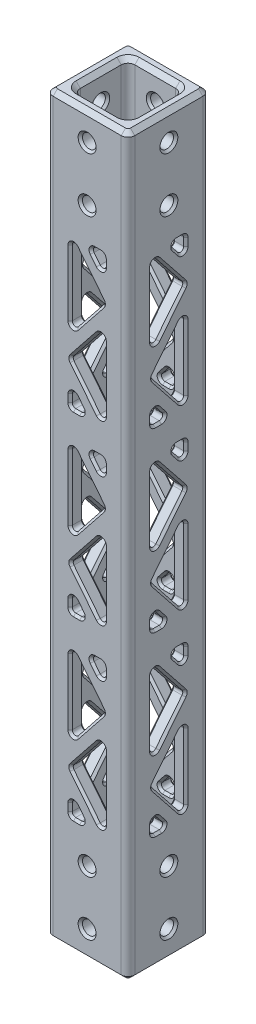
from build123d import *

# Parameters (mm, degrees)
SKETCH1_W                    = 19.05
SKETCH1_H                    = 19.05
SKETCH1_W_2                  = 12.7
SKETCH1_H_2                  = 12.7
BOSS_EXTRUDE1_DEPTH          = 85.725
F_1_8_0_125_DIAMETER_HOLE1_D = 3.175
F_1_8_0_125_DIAMETER_HOLE2_D = 3.175
F_1_8_0_125_DIAMETER_HOLE3_D = 3.175
CUT_EXTRUDE1_REACH           = 88.777
CIRPATTERN1_COUNT            = 4
FILLET1_R                    = 1.5875
FILLET2_R                    = 0.79375
CHAMFER2_SIZE                = 1.016
CHAMFER1_SIZE                = 0.508


with BuildPart() as part:
    # Sketch1 → Boss-Extrude1 (new, symmetric)
    with BuildSketch(Plane(origin=(0, 0, 0), x_dir=(1, 0, 0), z_dir=(0, 1, 0))):
        Rectangle(SKETCH1_W, SKETCH1_H)
        Rectangle(SKETCH1_W_2, SKETCH1_H_2, mode=Mode.SUBTRACT)
    extrude(amount=BOSS_EXTRUDE1_DEPTH, both=True)

    # 1/8 (0.125) Diameter Hole1 (through all)
    with Locations(Plane.ZY.offset(9.525)):
        with Locations((0, 79.375), (0, 66.675)):
            Hole(F_1_8_0_125_DIAMETER_HOLE1_D / 2)

    # 1/8 (0.125) Diameter Hole2 (through all)
    with Locations(Plane.ZY.offset(9.525)):
        with Locations((0, -66.675), (0, -79.375)):
            Hole(F_1_8_0_125_DIAMETER_HOLE2_D / 2)

    # 1/8 (0.125) Diameter Hole3 (through all)
    with Locations(Plane.XY.offset(9.525)):
        with Locations((0, 79.375), (0, 66.675), (0, -66.675), (0, -79.375)):
            Hole(F_1_8_0_125_DIAMETER_HOLE3_D / 2)

    # Sketch14 → Cut-Extrude1 (cut, up to next)
    with BuildSketch(Plane(origin=(0, 0, 0), x_dir=(0, 0, -1), z_dir=(1, 0, 0)), mode=Mode.PRIVATE) as cut_extrude1_sk1:
        Polygon((-3.96875, 58.7375), (-0.093532815, 58.7375), (-3.96875, 53.882145213), align=None)
    cut_extrude1_tool1 = extrude(cut_extrude1_sk1.sketch, amount=-CUT_EXTRUDE1_REACH, mode=Mode.PRIVATE) & part.part
    # Sketch14 → Cut-Extrude1 (cut, up to next)
    with BuildSketch(Plane(origin=(0, 0, 0), x_dir=(0, 0, -1), z_dir=(1, 0, 0)), mode=Mode.PRIVATE) as cut_extrude1_sk2:
        Polygon((3.96875, 58.7375), (-3.96875, 48.792411303), (3.96875, 38.847322606), align=None)
    cut_extrude1_tool2 = extrude(cut_extrude1_sk2.sketch, amount=-CUT_EXTRUDE1_REACH, mode=Mode.PRIVATE) & part.part
    # Sketch14 → Cut-Extrude1 (cut, up to next)
    with BuildSketch(Plane(origin=(0, 0, 0), x_dir=(0, 0, -1), z_dir=(1, 0, 0)), mode=Mode.PRIVATE) as cut_extrude1_sk3:
        Polygon((-3.96875, 23.8125), (3.96875, 33.757588697), (-3.96875, 43.702677394), align=None)
    cut_extrude1_tool3 = extrude(cut_extrude1_sk3.sketch, amount=-CUT_EXTRUDE1_REACH, mode=Mode.PRIVATE) & part.part
    # Sketch14 → Cut-Extrude1 (cut, up to next)
    with BuildSketch(Plane(origin=(0, 0, 0), x_dir=(0, 0, -1), z_dir=(1, 0, 0)), mode=Mode.PRIVATE) as cut_extrude1_sk4:
        Polygon((0.093532815, 23.8125), (3.96875, 23.8125), (3.96875, 28.667854787), align=None)
    cut_extrude1_tool4 = extrude(cut_extrude1_sk4.sketch, amount=-CUT_EXTRUDE1_REACH, mode=Mode.PRIVATE) & part.part
    # Sketch14 → Cut-Extrude1 (cut, up to next)
    with BuildSketch(Plane(origin=(0, 0, 0), x_dir=(0, 0, -1), z_dir=(1, 0, 0)), mode=Mode.PRIVATE) as cut_extrude1_sk5:
        Polygon((-3.96875, 17.4625), (-0.093532815, 17.4625), (-3.96875, 12.607145213), align=None)
    cut_extrude1_tool5 = extrude(cut_extrude1_sk5.sketch, amount=-CUT_EXTRUDE1_REACH, mode=Mode.PRIVATE) & part.part
    # Sketch14 → Cut-Extrude1 (cut, up to next)
    with BuildSketch(Plane(origin=(0, 0, 0), x_dir=(0, 0, -1), z_dir=(1, 0, 0)), mode=Mode.PRIVATE) as cut_extrude1_sk6:
        Polygon((3.96875, 17.4625), (-3.96875, 7.517411303), (3.96875, -2.427677394), align=None)
    cut_extrude1_tool6 = extrude(cut_extrude1_sk6.sketch, amount=-CUT_EXTRUDE1_REACH, mode=Mode.PRIVATE) & part.part
    # Sketch14 → Cut-Extrude1 (cut, up to next)
    with BuildSketch(Plane(origin=(0, 0, 0), x_dir=(0, 0, -1), z_dir=(1, 0, 0)), mode=Mode.PRIVATE) as cut_extrude1_sk7:
        Polygon((-3.96875, -17.4625), (3.96875, -7.517411303), (-3.96875, 2.427677394), align=None)
    cut_extrude1_tool7 = extrude(cut_extrude1_sk7.sketch, amount=-CUT_EXTRUDE1_REACH, mode=Mode.PRIVATE) & part.part
    # Sketch14 → Cut-Extrude1 (cut, up to next)
    with BuildSketch(Plane(origin=(0, 0, 0), x_dir=(0, 0, -1), z_dir=(1, 0, 0)), mode=Mode.PRIVATE) as cut_extrude1_sk8:
        Polygon((0.093532815, -17.4625), (3.96875, -17.4625), (3.96875, -12.607145213), align=None)
    cut_extrude1_tool8 = extrude(cut_extrude1_sk8.sketch, amount=-CUT_EXTRUDE1_REACH, mode=Mode.PRIVATE) & part.part
    # Sketch14 → Cut-Extrude1 (cut, up to next)
    with BuildSketch(Plane(origin=(0, 0, 0), x_dir=(0, 0, -1), z_dir=(1, 0, 0)), mode=Mode.PRIVATE) as cut_extrude1_sk9:
        Polygon((-3.96875, -23.8125), (-0.093532815, -23.8125), (-3.96875, -28.667854787), align=None)
    cut_extrude1_tool9 = extrude(cut_extrude1_sk9.sketch, amount=-CUT_EXTRUDE1_REACH, mode=Mode.PRIVATE) & part.part
    # Sketch14 → Cut-Extrude1 (cut, up to next)
    with BuildSketch(Plane(origin=(0, 0, 0), x_dir=(0, 0, -1), z_dir=(1, 0, 0)), mode=Mode.PRIVATE) as cut_extrude1_sk10:
        Polygon((3.96875, -23.8125), (-3.96875, -33.757588697), (3.96875, -43.702677394), align=None)
    cut_extrude1_tool10 = extrude(cut_extrude1_sk10.sketch, amount=-CUT_EXTRUDE1_REACH, mode=Mode.PRIVATE) & part.part
    # Sketch14 → Cut-Extrude1 (cut, up to next)
    with BuildSketch(Plane(origin=(0, 0, 0), x_dir=(0, 0, -1), z_dir=(1, 0, 0)), mode=Mode.PRIVATE) as cut_extrude1_sk11:
        Polygon((3.96875, -58.7375), (0.093532815, -58.7375), (3.96875, -53.882145213), align=None)
    cut_extrude1_tool11 = extrude(cut_extrude1_sk11.sketch, amount=-CUT_EXTRUDE1_REACH, mode=Mode.PRIVATE) & part.part
    # Sketch14 → Cut-Extrude1 (cut, up to next)
    with BuildSketch(Plane(origin=(0, 0, 0), x_dir=(0, 0, -1), z_dir=(1, 0, 0)), mode=Mode.PRIVATE) as cut_extrude1_sk12:
        Polygon((-3.96875, -58.7375), (3.96875, -48.792411303), (-3.96875, -38.847322606), align=None)
    cut_extrude1_tool12 = extrude(cut_extrude1_sk12.sketch, amount=-CUT_EXTRUDE1_REACH, mode=Mode.PRIVATE) & part.part
    cut_extrude1_1 = cut_extrude1_tool1.solids().sort_by_distance((0, 57.119048, 2.677011))[0]
    add(cut_extrude1_1, mode=Mode.SUBTRACT)
    cut_extrude1_2 = cut_extrude1_tool2.solids().sort_by_distance((0, 48.792411, -1.322917))[0]
    add(cut_extrude1_2, mode=Mode.SUBTRACT)
    cut_extrude1_3 = cut_extrude1_tool3.solids().sort_by_distance((0, 33.757589, 1.322917))[0]
    add(cut_extrude1_3, mode=Mode.SUBTRACT)
    cut_extrude1_4 = cut_extrude1_tool4.solids().sort_by_distance((0, 25.430952, -2.677011))[0]
    add(cut_extrude1_4, mode=Mode.SUBTRACT)
    cut_extrude1_5 = cut_extrude1_tool5.solids().sort_by_distance((0, 15.844048, 2.677011))[0]
    add(cut_extrude1_5, mode=Mode.SUBTRACT)
    cut_extrude1_6 = cut_extrude1_tool6.solids().sort_by_distance((0, 7.517411, -1.322917))[0]
    add(cut_extrude1_6, mode=Mode.SUBTRACT)
    cut_extrude1_7 = cut_extrude1_tool7.solids().sort_by_distance((0, -7.517411, 1.322917))[0]
    add(cut_extrude1_7, mode=Mode.SUBTRACT)
    cut_extrude1_8 = cut_extrude1_tool8.solids().sort_by_distance((0, -15.844048, -2.677011))[0]
    add(cut_extrude1_8, mode=Mode.SUBTRACT)
    cut_extrude1_9 = cut_extrude1_tool9.solids().sort_by_distance((0, -25.430952, 2.677011))[0]
    add(cut_extrude1_9, mode=Mode.SUBTRACT)
    cut_extrude1_10 = cut_extrude1_tool10.solids().sort_by_distance((0, -33.757589, -1.322917))[0]
    add(cut_extrude1_10, mode=Mode.SUBTRACT)
    cut_extrude1_11 = cut_extrude1_tool11.solids().sort_by_distance((0, -57.119048, -2.677011))[0]
    add(cut_extrude1_11, mode=Mode.SUBTRACT)
    cut_extrude1_12 = cut_extrude1_tool12.solids().sort_by_distance((0, -48.792411, 1.322917))[0]
    add(cut_extrude1_12, mode=Mode.SUBTRACT)
    cut_extrude1 = cut_extrude1_1 + cut_extrude1_2 + cut_extrude1_3 + cut_extrude1_4 + cut_extrude1_5 + cut_extrude1_6 + cut_extrude1_7 + cut_extrude1_8 + cut_extrude1_9 + cut_extrude1_10 + cut_extrude1_11 + cut_extrude1_12  # Cut-Extrude1 as one shape, for the pattern or mirror that repeats it

    # CirPattern1: Cut-Extrude1 ×4 about axis
    cirpattern1_axis = Axis((0, 0, 0), (0, 1, 0))
    for i in range(1, CIRPATTERN1_COUNT):
        add(cut_extrude1.rotate(cirpattern1_axis, i * 360 / CIRPATTERN1_COUNT), mode=Mode.SUBTRACT)

    # Fillet1
    fillet1_edges = [part.edges().sort_by_distance(p)[0] for p in [
        (6.35, 0, 6.35),
        (6.35, 0, -6.35),
        (-6.35, 0, -6.35),
        (-6.35, 0, 6.35),
        (9.525, 0, 9.525),
        (-9.525, 0, 9.525),
        (-9.525, 0, -9.525),
        (9.525, 0, -9.525),
    ]]
    fillet(fillet1_edges, radius=FILLET1_R)

    # Fillet2
    fillet2_edges = [part.edges().sort_by_distance(p)[0] for p in [
        (-7.9375, 12.607145213, 3.96875),
        (-7.9375, 17.4625, 3.96875),
        (-7.9375, 17.4625, 0.093532815),
        (-7.9375, 23.8125, 3.96875),
        (-7.9375, 43.702677394, 3.96875),
        (-7.9375, 33.757588697, -3.96875),
        (-7.9375, 28.667854787, -3.96875),
        (-7.9375, 23.8125, -3.96875),
        (-7.9375, 23.8125, -0.093532815),
        (-7.9375, 17.4625, -3.96875),
        (-7.9375, -2.427677394, -3.96875),
        (-7.9375, 7.517411303, 3.96875),
        (-7.9375, 58.7375, -3.96875),
        (-7.9375, 38.847322606, -3.96875),
        (-7.9375, 48.792411303, 3.96875),
        (-7.9375, -53.882145213, -3.96875),
        (-7.9375, -58.7375, -3.96875),
        (-7.9375, -58.7375, -0.093532815),
        (-7.9375, -17.4625, -0.093532815),
        (-7.9375, -12.607145213, -3.96875),
        (-7.9375, -17.4625, -3.96875),
        (-7.9375, -58.7375, 3.96875),
        (-7.9375, -38.847322606, 3.96875),
        (-7.9375, -48.792411303, -3.96875),
        (-7.9375, -23.8125, -3.96875),
        (-7.9375, -43.702677394, -3.96875),
        (-7.9375, -33.757588697, 3.96875),
        (-7.9375, -28.667854787, 3.96875),
        (-7.9375, -23.8125, 3.96875),
        (-7.9375, -23.8125, 0.093532815),
        (-7.9375, -17.4625, 3.96875),
        (-7.9375, 2.427677394, 3.96875),
        (-7.9375, -7.517411303, -3.96875),
        (-7.9375, 53.882145213, 3.96875),
        (-7.9375, 58.7375, 3.96875),
        (-7.9375, 58.7375, 0.093532815),
        (7.9375, -17.4625, -3.96875),
        (7.9375, 2.427677394, -3.96875),
        (7.9375, -7.517411303, 3.96875),
        (7.9375, -28.667854787, -3.96875),
        (7.9375, -23.8125, -3.96875),
        (7.9375, -23.8125, -0.093532815),
        (7.9375, -23.8125, 3.96875),
        (7.9375, -43.702677394, 3.96875),
        (7.9375, -33.757588697, -3.96875),
        (-3.96875, 53.882145213, -7.9375),
        (-3.96875, 58.7375, -7.9375),
        (-0.093532815, 58.7375, -7.9375),
        (7.9375, 12.607145213, -3.96875),
        (7.9375, 17.4625, -3.96875),
        (7.9375, 17.4625, -0.093532815),
        (7.9375, 23.8125, -3.96875),
        (7.9375, 43.702677394, -3.96875),
        (7.9375, 33.757588697, 3.96875),
        (7.9375, 28.667854787, 3.96875),
        (7.9375, 23.8125, 3.96875),
        (7.9375, 23.8125, 0.093532815),
        (7.9375, 17.4625, 3.96875),
        (7.9375, -2.427677394, 3.96875),
        (7.9375, 7.517411303, -3.96875),
        (-3.96875, 12.607145213, -7.9375),
        (-3.96875, 17.4625, -7.9375),
        (-0.093532815, 17.4625, -7.9375),
        (-3.96875, 23.8125, -7.9375),
        (-3.96875, 43.702677394, -7.9375),
        (3.96875, 33.757588697, -7.9375),
        (3.96875, 28.667854787, -7.9375),
        (3.96875, 23.8125, -7.9375),
        (0.093532815, 23.8125, -7.9375),
        (3.96875, 17.4625, -7.9375),
        (3.96875, -2.427677394, -7.9375),
        (-3.96875, 7.517411303, -7.9375),
        (3.96875, 58.7375, -7.9375),
        (3.96875, 38.847322606, -7.9375),
        (-3.96875, 48.792411303, -7.9375),
        (3.96875, -53.882145213, -7.9375),
        (3.96875, -58.7375, -7.9375),
        (0.093532815, -58.7375, -7.9375),
        (0.093532815, -17.4625, -7.9375),
        (3.96875, -12.607145213, -7.9375),
        (3.96875, -17.4625, -7.9375),
        (-3.96875, -58.7375, -7.9375),
        (-3.96875, -38.847322606, -7.9375),
        (3.96875, -48.792411303, -7.9375),
        (3.96875, 12.607145213, 7.9375),
        (3.96875, 17.4625, 7.9375),
        (0.093532815, 17.4625, 7.9375),
        (3.96875, 23.8125, 7.9375),
        (3.96875, 43.702677394, 7.9375),
        (-3.96875, 33.757588697, 7.9375),
        (-3.96875, 28.667854787, 7.9375),
        (-3.96875, 23.8125, 7.9375),
        (-0.093532815, 23.8125, 7.9375),
        (-3.96875, 17.4625, 7.9375),
        (-3.96875, -2.427677394, 7.9375),
        (3.96875, 7.517411303, 7.9375),
        (-3.96875, 58.7375, 7.9375),
        (-3.96875, 38.847322606, 7.9375),
        (3.96875, 48.792411303, 7.9375),
        (-3.96875, -53.882145213, 7.9375),
        (-3.96875, -58.7375, 7.9375),
        (-0.093532815, -58.7375, 7.9375),
        (-0.093532815, -17.4625, 7.9375),
        (-3.96875, -12.607145213, 7.9375),
        (-3.96875, -17.4625, 7.9375),
        (3.96875, -58.7375, 7.9375),
        (3.96875, -38.847322606, 7.9375),
        (-3.96875, -48.792411303, 7.9375),
        (7.9375, 58.7375, 3.96875),
        (7.9375, 38.847322606, 3.96875),
        (7.9375, 48.792411303, -3.96875),
        (7.9375, -53.882145213, 3.96875),
        (7.9375, -58.7375, 3.96875),
        (7.9375, -58.7375, 0.093532815),
        (7.9375, -17.4625, 0.093532815),
        (7.9375, -12.607145213, 3.96875),
        (7.9375, -17.4625, 3.96875),
        (7.9375, -58.7375, -3.96875),
        (7.9375, -38.847322606, -3.96875),
        (7.9375, -48.792411303, 3.96875),
        (3.96875, -17.4625, 7.9375),
        (3.96875, 2.427677394, 7.9375),
        (-3.96875, -7.517411303, 7.9375),
        (3.96875, -28.667854787, 7.9375),
        (3.96875, -23.8125, 7.9375),
        (0.093532815, -23.8125, 7.9375),
        (-3.96875, -23.8125, 7.9375),
        (-3.96875, -43.702677394, 7.9375),
        (3.96875, -33.757588697, 7.9375),
        (7.9375, 53.882145213, -3.96875),
        (7.9375, 58.7375, -3.96875),
        (7.9375, 58.7375, -0.093532815),
        (3.96875, -23.8125, -7.9375),
        (3.96875, -43.702677394, -7.9375),
        (-3.96875, -33.757588697, -7.9375),
        (-3.96875, -28.667854787, -7.9375),
        (-3.96875, -23.8125, -7.9375),
        (-0.093532815, -23.8125, -7.9375),
        (-3.96875, -17.4625, -7.9375),
        (-3.96875, 2.427677394, -7.9375),
        (3.96875, -7.517411303, -7.9375),
        (3.96875, 53.882145213, 7.9375),
        (3.96875, 58.7375, 7.9375),
        (0.093532815, 58.7375, 7.9375),
    ]]
    fillet(fillet2_edges, radius=FILLET2_R)

    # Chamfer2
    chamfer2_edges = [part.edges().sort_by_distance(p)[0] for p in [
        (0, -85.725, -9.525),
        (0, 85.725, -9.525),
        (9.525, -85.725, 0),
        (0, -85.725, 9.525),
        (-9.525, -85.725, 0),
        (0, -85.725, 6.35),
        (6.35, -85.725, 0),
        (0, -85.725, -6.35),
        (-6.35, -85.725, 0),
        (-9.060032015, -85.725, 9.060032015),
        (-9.060032015, -85.725, -9.060032015),
        (9.060032015, -85.725, 9.060032015),
        (9.060032015, -85.725, -9.060032015),
        (9.525, 85.725, 0),
        (-9.525, 85.725, 0),
        (0, 85.725, 9.525),
        (6.35, 85.725, 0),
        (0, 85.725, 6.35),
        (-6.35, 85.725, 0),
        (0, 85.725, -6.35),
        (-9.060032015, 85.725, 9.060032015),
        (-9.060032015, 85.725, -9.060032015),
        (9.060032015, 85.725, 9.060032015),
        (9.060032015, 85.725, -9.060032015),
        (5.885032015, -85.725, -5.885032015),
        (5.885032015, 85.725, -5.885032015),
        (5.885032015, -85.725, 5.885032015),
        (5.885032015, 85.725, 5.885032015),
        (-5.885032015, -85.725, 5.885032015),
        (-5.885032015, 85.725, 5.885032015),
        (-5.885032015, -85.725, -5.885032015),
        (-5.885032015, 85.725, -5.885032015),
    ]]
    chamfer(chamfer2_edges, length=CHAMFER2_SIZE)

    # Chamfer1
    chamfer1_edges = [part.edges().sort_by_distance(p)[0] for p in [
        (-3.43730991, 25.330287774, -6.35),
        (-3.43730991, 25.330287774, -9.525),
        (3.746929296, 33.757588697, -6.35),
        (3.746929296, 33.757588697, -9.525),
        (-3.43730991, 42.184889619, -6.35),
        (-3.43730991, 42.184889619, -9.525),
        (-3.43730991, 14.124932987, -6.35),
        (-3.43730991, 14.124932987, -9.525),
        (-1.027407916, 17.013001163, -6.35),
        (-1.027407916, 17.013001163, -9.525),
        (-3.736266008, 17.230016008, -6.35),
        (-3.736266008, 17.230016008, -9.525),
        (-3.43730991, -57.219712226, -6.35),
        (-3.43730991, -57.219712226, -9.525),
        (3.746929296, -48.792411303, -6.35),
        (3.746929296, -48.792411303, -9.525),
        (-3.43730991, -40.365110381, -6.35),
        (-3.43730991, -40.365110381, -9.525),
        (1.027407916, -17.013001163, -6.35),
        (1.027407916, -17.013001163, -9.525),
        (3.736266008, -17.230016008, -6.35),
        (3.736266008, -17.230016008, -9.525),
        (3.43730991, -14.124932987, -6.35),
        (3.43730991, -14.124932987, -9.525),
        (3.43730991, -55.399932987, -6.35),
        (3.43730991, -55.399932987, -9.525),
        (1.027407916, -58.288001163, -6.35),
        (1.027407916, -58.288001163, -9.525),
        (3.736266008, -58.505016008, -6.35),
        (3.736266008, -58.505016008, -9.525),
        (3.43730991, 57.219712226, -6.35),
        (3.43730991, 57.219712226, -9.525),
        (-3.746929296, 48.792411303, -6.35),
        (-3.746929296, 48.792411303, -9.525),
        (3.43730991, 40.365110381, -6.35),
        (3.43730991, 40.365110381, -9.525),
        (-3.43730991, 55.399932987, -6.35),
        (-3.43730991, 55.399932987, -9.525),
        (-1.027407916, 58.288001163, -6.35),
        (-1.027407916, 58.288001163, -9.525),
        (-3.736266008, 58.505016008, -6.35),
        (-3.736266008, 58.505016008, -9.525),
        (6.35, -25.330287774, 3.43730991),
        (9.525, -25.330287774, 3.43730991),
        (6.35, -33.757588697, -3.746929296),
        (9.525, -33.757588697, -3.746929296),
        (6.35, -42.184889619, 3.43730991),
        (9.525, -42.184889619, 3.43730991),
        (6.35, -27.150067013, -3.43730991),
        (9.525, -27.150067013, -3.43730991),
        (6.35, -24.261998837, -1.027407916),
        (9.525, -24.261998837, -1.027407916),
        (6.35, -24.044983992, -3.736266008),
        (9.525, -24.044983992, -3.736266008),
        (6.35, -15.944712226, -3.43730991),
        (9.525, -15.944712226, -3.43730991),
        (6.35, -7.517411303, 3.746929296),
        (9.525, -7.517411303, 3.746929296),
        (6.35, 0.909889619, -3.43730991),
        (9.525, 0.909889619, -3.43730991),
        (6.35, 15.944712226, 3.43730991),
        (9.525, 15.944712226, 3.43730991),
        (6.35, 7.517411303, -3.746929296),
        (9.525, 7.517411303, -3.746929296),
        (6.35, -0.909889619, 3.43730991),
        (9.525, -0.909889619, 3.43730991),
        (6.35, 27.150067013, 3.43730991),
        (9.525, 27.150067013, 3.43730991),
        (6.35, 24.261998837, 1.027407916),
        (9.525, 24.261998837, 1.027407916),
        (6.35, 24.044983992, 3.736266008),
        (9.525, 24.044983992, 3.736266008),
        (6.35, 25.330287774, -3.43730991),
        (9.525, 25.330287774, -3.43730991),
        (6.35, 33.757588697, 3.746929296),
        (9.525, 33.757588697, 3.746929296),
        (6.35, 42.184889619, -3.43730991),
        (9.525, 42.184889619, -3.43730991),
        (6.35, 14.124932987, -3.43730991),
        (9.525, 14.124932987, -3.43730991),
        (6.35, 17.013001163, -1.027407916),
        (9.525, 17.013001163, -1.027407916),
        (6.35, 17.230016008, -3.736266008),
        (9.525, 17.230016008, -3.736266008),
        (6.35, -57.219712226, -3.43730991),
        (9.525, -57.219712226, -3.43730991),
        (6.35, -48.792411303, 3.746929296),
        (9.525, -48.792411303, 3.746929296),
        (6.35, -40.365110381, -3.43730991),
        (9.525, -40.365110381, -3.43730991),
        (6.35, -17.013001163, 1.027407916),
        (9.525, -17.013001163, 1.027407916),
        (6.35, -17.230016008, 3.736266008),
        (9.525, -17.230016008, 3.736266008),
        (6.35, -14.124932987, 3.43730991),
        (9.525, -14.124932987, 3.43730991),
        (6.35, -55.399932987, 3.43730991),
        (9.525, -55.399932987, 3.43730991),
        (6.35, -58.288001163, 1.027407916),
        (9.525, -58.288001163, 1.027407916),
        (6.35, -58.505016008, 3.736266008),
        (9.525, -58.505016008, 3.736266008),
        (6.35, 57.219712226, 3.43730991),
        (9.525, 57.219712226, 3.43730991),
        (6.35, 48.792411303, -3.746929296),
        (9.525, 48.792411303, -3.746929296),
        (6.35, 40.365110381, 3.43730991),
        (9.525, 40.365110381, 3.43730991),
        (6.35, 55.399932987, -3.43730991),
        (9.525, 55.399932987, -3.43730991),
        (6.35, 58.288001163, -1.027407916),
        (9.525, 58.288001163, -1.027407916),
        (-3.43730991, -25.330287774, 6.35),
        (-3.43730991, -25.330287774, 9.525),
        (3.746929296, -33.757588697, 6.35),
        (3.746929296, -33.757588697, 9.525),
        (-3.43730991, -42.184889619, 6.35),
        (-3.43730991, -42.184889619, 9.525),
        (3.43730991, -27.150067013, 6.35),
        (3.43730991, -27.150067013, 9.525),
        (1.027407916, -24.261998837, 6.35),
        (1.027407916, -24.261998837, 9.525),
        (3.736266008, -24.044983992, 6.35),
        (3.736266008, -24.044983992, 9.525),
        (3.43730991, -15.944712226, 6.35),
        (3.43730991, -15.944712226, 9.525),
        (-3.746929296, -7.517411303, 6.35),
        (-3.746929296, -7.517411303, 9.525),
        (3.43730991, 0.909889619, 6.35),
        (3.43730991, 0.909889619, 9.525),
        (-3.43730991, 15.944712226, 6.35),
        (-3.43730991, 15.944712226, 9.525),
        (3.746929296, 7.517411303, 6.35),
        (3.746929296, 7.517411303, 9.525),
        (-3.43730991, -0.909889619, 6.35),
        (-3.43730991, -0.909889619, 9.525),
        (-3.43730991, 27.150067013, 6.35),
        (-3.43730991, 27.150067013, 9.525),
        (-1.027407916, 24.261998837, 6.35),
        (-1.027407916, 24.261998837, 9.525),
        (-3.736266008, 24.044983992, 6.35),
        (-3.736266008, 24.044983992, 9.525),
        (3.43730991, 25.330287774, 6.35),
        (3.43730991, 25.330287774, 9.525),
        (-3.746929296, 33.757588697, 6.35),
        (-3.746929296, 33.757588697, 9.525),
        (3.43730991, 42.184889619, 6.35),
        (3.43730991, 42.184889619, 9.525),
        (3.43730991, 14.124932987, 6.35),
        (3.43730991, 14.124932987, 9.525),
        (1.027407916, 17.013001163, 6.35),
        (1.027407916, 17.013001163, 9.525),
        (3.736266008, 17.230016008, 6.35),
        (3.736266008, 17.230016008, 9.525),
        (3.43730991, -57.219712226, 6.35),
        (3.43730991, -57.219712226, 9.525),
        (-3.746929296, -48.792411303, 6.35),
        (-3.746929296, -48.792411303, 9.525),
        (3.43730991, -40.365110381, 6.35),
        (3.43730991, -40.365110381, 9.525),
        (-1.027407916, -17.013001163, 6.35),
        (-1.027407916, -17.013001163, 9.525),
        (-3.736266008, -17.230016008, 6.35),
        (-3.736266008, -17.230016008, 9.525),
        (-3.43730991, -14.124932987, 6.35),
        (-3.43730991, -14.124932987, 9.525),
        (-3.43730991, -55.399932987, 6.35),
        (-3.43730991, -55.399932987, 9.525),
        (-1.027407916, -58.288001163, 6.35),
        (-1.027407916, -58.288001163, 9.525),
        (-3.736266008, -58.505016008, 6.35),
        (-3.736266008, -58.505016008, 9.525),
        (-3.43730991, 57.219712226, 6.35),
        (-3.43730991, 57.219712226, 9.525),
        (3.746929296, 48.792411303, 6.35),
        (3.746929296, 48.792411303, 9.525),
        (-3.43730991, 40.365110381, 6.35),
        (-3.43730991, 40.365110381, 9.525),
        (3.43730991, 55.399932987, 6.35),
        (3.43730991, 55.399932987, 9.525),
        (1.027407916, 58.288001163, 6.35),
        (1.027407916, 58.288001163, 9.525),
        (3.736266008, 58.505016008, 6.35),
        (3.736266008, 58.505016008, 9.525),
        (6.35, 58.505016008, -3.736266008),
        (9.525, 58.505016008, -3.736266008),
        (6.35, 66.675, 1.5875),
        (-6.35, 66.675, 1.5875),
        (-9.525, 66.675, 1.5875),
        (9.525, 66.675, 1.5875),
        (6.35, 79.375, 1.5875),
        (-6.35, 79.375, 1.5875),
        (-9.525, 79.375, 1.5875),
        (9.525, 79.375, 1.5875),
        (6.35, -79.375, 1.5875),
        (-6.35, -79.375, 1.5875),
        (-9.525, -79.375, 1.5875),
        (9.525, -79.375, 1.5875),
        (6.35, -66.675, 1.5875),
        (-6.35, -66.675, 1.5875),
        (-9.525, -66.675, 1.5875),
        (9.525, -66.675, 1.5875),
        (-9.525, -58.7375, -2.458810655),
        (-6.35, -58.7375, -2.458810655),
        (-9.525, -56.551273789, -1.838431335),
        (-6.35, -56.551273789, -1.838431335),
        (-9.525, -57.04641878, -3.96875),
        (-6.35, -57.04641878, -3.96875),
        (-9.525, -44.458193137, -0.509468968),
        (-6.35, -44.458193137, -0.509468968),
        (-9.525, -53.126629469, -0.509468968),
        (-6.35, -53.126629469, -0.509468968),
        (-9.525, -48.792411303, 3.96875),
        (-6.35, -48.792411303, 3.96875),
        (-9.525, -38.091806863, 0.509468968),
        (-6.35, -38.091806863, 0.509468968),
        (-9.525, -29.423370531, 0.509468968),
        (-6.35, -29.423370531, 0.509468968),
        (-9.525, -33.757588697, -3.96875),
        (-6.35, -33.757588697, -3.96875),
        (-9.525, -25.998726211, 1.838431335),
        (-6.35, -25.998726211, 1.838431335),
        (-9.525, -25.50358122, 3.96875),
        (-6.35, -25.50358122, 3.96875),
        (-9.525, -23.8125, 2.458810655),
        (-6.35, -23.8125, 2.458810655),
        (-9.525, -15.77141878, -3.96875),
        (-6.35, -15.77141878, -3.96875),
        (-9.525, -17.4625, -2.458810655),
        (-6.35, -17.4625, -2.458810655),
        (-9.525, -15.276273789, -1.838431335),
        (-6.35, -15.276273789, -1.838431335),
        (-9.525, -11.851629469, -0.509468968),
        (-6.35, -11.851629469, -0.509468968),
        (-9.525, -7.517411303, 3.96875),
        (-6.35, -7.517411303, 3.96875),
        (-9.525, -3.183193137, -0.509468968),
        (-6.35, -3.183193137, -0.509468968),
        (-9.525, 3.183193137, 0.509468968),
        (-6.35, 3.183193137, 0.509468968),
        (-9.525, 11.851629469, 0.509468968),
        (-6.35, 11.851629469, 0.509468968),
        (-9.525, 7.517411303, -3.96875),
        (-6.35, 7.517411303, -3.96875),
        (-9.525, 17.4625, 2.458810655),
        (-6.35, 17.4625, 2.458810655),
        (-9.525, 15.276273789, 1.838431335),
        (-6.35, 15.276273789, 1.838431335),
        (-9.525, 15.77141878, 3.96875),
        (-6.35, 15.77141878, 3.96875),
        (-9.525, 23.8125, -2.458810655),
        (-6.35, 23.8125, -2.458810655),
        (-9.525, 25.998726211, -1.838431335),
        (-6.35, 25.998726211, -1.838431335),
        (-9.525, 25.50358122, -3.96875),
        (-6.35, 25.50358122, -3.96875),
        (-9.525, 38.091806863, -0.509468968),
        (-6.35, 38.091806863, -0.509468968),
        (-9.525, 29.423370531, -0.509468968),
        (-6.35, 29.423370531, -0.509468968),
        (-9.525, 33.757588697, 3.96875),
        (-6.35, 33.757588697, 3.96875),
        (1.5875, -79.375, 6.35),
        (-9.525, 44.458193137, 0.509468968),
        (1.5875, -79.375, -6.35),
        (-6.35, 44.458193137, 0.509468968),
        (1.5875, -79.375, -9.525),
        (-9.525, 53.126629469, 0.509468968),
        (1.5875, -79.375, 9.525),
        (-6.35, 53.126629469, 0.509468968),
        (-9.525, 48.792411303, -3.96875),
        (-6.35, 48.792411303, -3.96875),
        (-9.525, 58.7375, 2.458810655),
        (-6.35, 58.7375, 2.458810655),
        (-9.525, 56.551273789, 1.838431335),
        (-6.35, 56.551273789, 1.838431335),
        (-9.525, 57.04641878, 3.96875),
        (-6.35, 57.04641878, 3.96875),
        (-0.509468968, -29.423370531, -9.525),
        (-0.509468968, -29.423370531, -6.35),
        (3.96875, -33.757588697, -9.525),
        (3.96875, -33.757588697, -6.35),
        (-0.509468968, -38.091806863, -9.525),
        (-0.509468968, -38.091806863, -6.35),
        (-1.838431335, -25.998726211, -9.525),
        (-1.838431335, -25.998726211, -6.35),
        (-3.96875, -25.50358122, -9.525),
        (-3.96875, -25.50358122, -6.35),
        (-2.458810655, -23.8125, -9.525),
        (-2.458810655, -23.8125, -6.35),
        (0.509468968, -11.851629469, -9.525),
        (0.509468968, -11.851629469, -6.35),
        (-3.96875, -7.517411303, -9.525),
        (-3.96875, -7.517411303, -6.35),
        (0.509468968, -3.183193137, -9.525),
        (0.509468968, -3.183193137, -6.35),
        (-0.509468968, 11.851629469, -9.525),
        (-0.509468968, 11.851629469, -6.35),
        (3.96875, 7.517411303, -9.525),
        (3.96875, 7.517411303, -6.35),
        (-0.509468968, 3.183193137, -9.525),
        (-0.509468968, 3.183193137, -6.35),
        (1.838431335, 25.998726211, -9.525),
        (1.838431335, 25.998726211, -6.35),
        (3.96875, 25.50358122, -9.525),
        (3.96875, 25.50358122, -6.35),
        (2.458810655, 23.8125, -9.525),
        (2.458810655, 23.8125, -6.35),
        (0.509468968, 29.423370531, -9.525),
        (0.509468968, 29.423370531, -6.35),
        (-3.96875, 33.757588697, -9.525),
        (-3.96875, 33.757588697, -6.35),
        (0.509468968, 38.091806863, -9.525),
        (0.509468968, 38.091806863, -6.35),
        (-1.838431335, 15.276273789, -9.525),
        (-1.838431335, 15.276273789, -6.35),
        (-3.96875, 15.77141878, -9.525),
        (-3.96875, 15.77141878, -6.35),
        (-2.458810655, 17.4625, -9.525),
        (-2.458810655, 17.4625, -6.35),
        (0.509468968, -53.126629469, -9.525),
        (0.509468968, -53.126629469, -6.35),
        (-3.96875, -48.792411303, -9.525),
        (-3.96875, -48.792411303, -6.35),
        (0.509468968, -44.458193137, -9.525),
        (0.509468968, -44.458193137, -6.35),
        (2.458810655, -17.4625, -9.525),
        (2.458810655, -17.4625, -6.35),
        (1.838431335, -15.276273789, -9.525),
        (1.838431335, -15.276273789, -6.35),
        (3.96875, -15.77141878, -9.525),
        (3.96875, -15.77141878, -6.35),
        (1.838431335, -56.551273789, -9.525),
        (1.838431335, -56.551273789, -6.35),
        (3.96875, -57.04641878, -9.525),
        (3.96875, -57.04641878, -6.35),
        (2.458810655, -58.7375, -9.525),
        (2.458810655, -58.7375, -6.35),
        (-0.509468968, 53.126629469, -9.525),
        (-0.509468968, 53.126629469, -6.35),
        (3.96875, 48.792411303, -9.525),
        (3.96875, 48.792411303, -6.35),
        (-0.509468968, 44.458193137, -9.525),
        (-0.509468968, 44.458193137, -6.35),
        (1.5875, -66.675, -6.35),
        (-1.838431335, 56.551273789, -9.525),
        (-1.838431335, 56.551273789, -6.35),
        (1.5875, -66.675, 6.35),
        (1.5875, -66.675, 9.525),
        (-3.96875, 57.04641878, -9.525),
        (1.5875, -66.675, -9.525),
        (-3.96875, 57.04641878, -6.35),
        (-2.458810655, 58.7375, -9.525),
        (-2.458810655, 58.7375, -6.35),
        (9.525, -29.423370531, -0.509468968),
        (6.35, -29.423370531, -0.509468968),
        (9.525, -33.757588697, 3.96875),
        (6.35, -33.757588697, 3.96875),
        (9.525, -38.091806863, -0.509468968),
        (6.35, -38.091806863, -0.509468968),
        (9.525, -25.998726211, -1.838431335),
        (6.35, -25.998726211, -1.838431335),
        (9.525, -25.50358122, -3.96875),
        (6.35, -25.50358122, -3.96875),
        (9.525, -23.8125, -2.458810655),
        (6.35, -23.8125, -2.458810655),
        (9.525, -11.851629469, 0.509468968),
        (6.35, -11.851629469, 0.509468968),
        (9.525, -7.517411303, -3.96875),
        (6.35, -7.517411303, -3.96875),
        (9.525, -3.183193137, 0.509468968),
        (6.35, -3.183193137, 0.509468968),
        (9.525, 11.851629469, -0.509468968),
        (6.35, 11.851629469, -0.509468968),
        (9.525, 7.517411303, 3.96875),
        (6.35, 7.517411303, 3.96875),
        (9.525, 3.183193137, -0.509468968),
        (6.35, 3.183193137, -0.509468968),
        (9.525, 25.998726211, 1.838431335),
        (6.35, 25.998726211, 1.838431335),
        (9.525, 25.50358122, 3.96875),
        (6.35, 25.50358122, 3.96875),
        (9.525, 23.8125, 2.458810655),
        (6.35, 23.8125, 2.458810655),
        (9.525, 29.423370531, 0.509468968),
        (6.35, 29.423370531, 0.509468968),
        (9.525, 33.757588697, -3.96875),
        (6.35, 33.757588697, -3.96875),
        (9.525, 38.091806863, 0.509468968),
        (6.35, 38.091806863, 0.509468968),
        (9.525, 15.276273789, -1.838431335),
        (6.35, 15.276273789, -1.838431335),
        (9.525, 15.77141878, -3.96875),
        (6.35, 15.77141878, -3.96875),
        (9.525, 17.4625, -2.458810655),
        (6.35, 17.4625, -2.458810655),
        (9.525, -53.126629469, 0.509468968),
        (6.35, -53.126629469, 0.509468968),
        (9.525, -48.792411303, -3.96875),
        (6.35, -48.792411303, -3.96875),
        (9.525, -44.458193137, 0.509468968),
        (6.35, -44.458193137, 0.509468968),
        (9.525, -17.4625, 2.458810655),
        (6.35, -17.4625, 2.458810655),
        (9.525, -15.276273789, 1.838431335),
        (6.35, -15.276273789, 1.838431335),
        (9.525, -15.77141878, 3.96875),
        (6.35, -15.77141878, 3.96875),
        (9.525, -56.551273789, 1.838431335),
        (6.35, -56.551273789, 1.838431335),
        (9.525, -57.04641878, 3.96875),
        (6.35, -57.04641878, 3.96875),
        (9.525, -58.7375, 2.458810655),
        (6.35, -58.7375, 2.458810655),
        (9.525, 53.126629469, -0.509468968),
        (6.35, 53.126629469, -0.509468968),
        (9.525, 48.792411303, 3.96875),
        (6.35, 48.792411303, 3.96875),
        (9.525, 44.458193137, -0.509468968),
        (6.35, 44.458193137, -0.509468968),
        (9.525, 56.551273789, -1.838431335),
        (6.35, 56.551273789, -1.838431335),
        (9.525, 57.04641878, -3.96875),
        (6.35, 57.04641878, -3.96875),
        (9.525, 58.7375, -2.458810655),
        (6.35, 58.7375, -2.458810655),
        (1.5875, 66.675, 6.35),
        (0.509468968, -29.423370531, 9.525),
        (0.509468968, -29.423370531, 6.35),
        (1.5875, 66.675, -6.35),
        (1.5875, 66.675, -9.525),
        (-3.96875, -33.757588697, 9.525),
        (-3.96875, -33.757588697, 6.35),
        (1.5875, 66.675, 9.525),
        (0.509468968, -38.091806863, 9.525),
        (0.509468968, -38.091806863, 6.35),
        (1.838431335, -25.998726211, 9.525),
        (1.838431335, -25.998726211, 6.35),
        (3.96875, -25.50358122, 9.525),
        (3.96875, -25.50358122, 6.35),
        (2.458810655, -23.8125, 9.525),
        (2.458810655, -23.8125, 6.35),
        (-0.509468968, -11.851629469, 9.525),
        (-0.509468968, -11.851629469, 6.35),
        (3.96875, -7.517411303, 9.525),
        (3.96875, -7.517411303, 6.35),
        (-0.509468968, -3.183193137, 9.525),
        (-0.509468968, -3.183193137, 6.35),
        (0.509468968, 11.851629469, 9.525),
        (0.509468968, 11.851629469, 6.35),
        (-3.96875, 7.517411303, 9.525),
        (-3.96875, 7.517411303, 6.35),
        (0.509468968, 3.183193137, 9.525),
        (0.509468968, 3.183193137, 6.35),
        (-1.838431335, 25.998726211, 9.525),
        (-1.838431335, 25.998726211, 6.35),
        (-3.96875, 25.50358122, 9.525),
        (-3.96875, 25.50358122, 6.35),
        (-2.458810655, 23.8125, 9.525),
        (-2.458810655, 23.8125, 6.35),
        (-0.509468968, 29.423370531, 9.525),
        (-0.509468968, 29.423370531, 6.35),
        (3.96875, 33.757588697, 9.525),
        (3.96875, 33.757588697, 6.35),
        (-0.509468968, 38.091806863, 9.525),
        (-0.509468968, 38.091806863, 6.35),
        (1.838431335, 15.276273789, 9.525),
        (1.838431335, 15.276273789, 6.35),
        (3.96875, 15.77141878, 9.525),
        (3.96875, 15.77141878, 6.35),
        (2.458810655, 17.4625, 9.525),
        (2.458810655, 17.4625, 6.35),
        (-0.509468968, -53.126629469, 9.525),
        (-0.509468968, -53.126629469, 6.35),
        (3.96875, -48.792411303, 9.525),
        (3.96875, -48.792411303, 6.35),
        (-0.509468968, -44.458193137, 9.525),
        (-0.509468968, -44.458193137, 6.35),
        (-2.458810655, -17.4625, 9.525),
        (-2.458810655, -17.4625, 6.35),
        (-1.838431335, -15.276273789, 9.525),
        (-1.838431335, -15.276273789, 6.35),
        (-3.96875, -15.77141878, 9.525),
        (-3.96875, -15.77141878, 6.35),
        (-1.838431335, -56.551273789, 9.525),
        (-1.838431335, -56.551273789, 6.35),
        (-3.96875, -57.04641878, 9.525),
        (-3.96875, -57.04641878, 6.35),
        (-2.458810655, -58.7375, 9.525),
        (-2.458810655, -58.7375, 6.35),
        (0.509468968, 53.126629469, 9.525),
        (0.509468968, 53.126629469, 6.35),
        (-3.96875, 48.792411303, 9.525),
        (-3.96875, 48.792411303, 6.35),
        (0.509468968, 44.458193137, 9.525),
        (0.509468968, 44.458193137, 6.35),
        (1.838431335, 56.551273789, 9.525),
        (1.838431335, 56.551273789, 6.35),
        (3.96875, 57.04641878, 9.525),
        (3.96875, 57.04641878, 6.35),
        (2.458810655, 58.7375, 9.525),
        (2.458810655, 58.7375, 6.35),
        (-6.35, -58.288001163, -1.027407916),
        (-9.525, -58.288001163, -1.027407916),
        (-6.35, -58.505016008, -3.736266008),
        (-9.525, -58.505016008, -3.736266008),
        (-6.35, -55.399932987, -3.43730991),
        (-9.525, -55.399932987, -3.43730991),
        (-6.35, -48.792411303, -3.746929296),
        (-9.525, -48.792411303, -3.746929296),
        (-6.35, -57.219712226, 3.43730991),
        (-9.525, -57.219712226, 3.43730991),
        (-6.35, -40.365110381, 3.43730991),
        (-9.525, -40.365110381, 3.43730991),
        (-6.35, -33.757588697, 3.746929296),
        (-9.525, -33.757588697, 3.746929296),
        (-6.35, -42.184889619, -3.43730991),
        (-9.525, -42.184889619, -3.43730991),
        (-6.35, -25.330287774, -3.43730991),
        (1.5875, 79.375, 6.35),
        (-9.525, -25.330287774, -3.43730991),
        (-6.35, -27.150067013, 3.43730991),
        (-9.525, -27.150067013, 3.43730991),
        (1.5875, 79.375, -6.35),
        (-6.35, -24.044983992, 3.736266008),
        (-9.525, -24.044983992, 3.736266008),
        (1.5875, 79.375, -9.525),
        (-6.35, -24.261998837, 1.027407916),
        (-9.525, -24.261998837, 1.027407916),
        (-6.35, -17.230016008, -3.736266008),
        (1.5875, 79.375, 9.525),
        (-9.525, -17.230016008, -3.736266008),
        (-6.35, -17.013001163, -1.027407916),
        (-9.525, -17.013001163, -1.027407916),
        (-6.35, -14.124932987, -3.43730991),
        (-9.525, -14.124932987, -3.43730991),
        (-6.35, -15.944712226, 3.43730991),
        (-9.525, -15.944712226, 3.43730991),
        (-6.35, 0.909889619, 3.43730991),
        (-9.525, 0.909889619, 3.43730991),
        (-6.35, -7.517411303, -3.746929296),
        (-9.525, -7.517411303, -3.746929296),
        (-6.35, 7.517411303, 3.746929296),
        (-9.525, 7.517411303, 3.746929296),
        (-6.35, -0.909889619, -3.43730991),
        (-9.525, -0.909889619, -3.43730991),
        (-6.35, 15.944712226, -3.43730991),
        (-9.525, 15.944712226, -3.43730991),
        (-6.35, 17.013001163, 1.027407916),
        (-9.525, 17.013001163, 1.027407916),
        (-6.35, 14.124932987, 3.43730991),
        (-9.525, 14.124932987, 3.43730991),
        (-6.35, 17.230016008, 3.736266008),
        (-9.525, 17.230016008, 3.736266008),
        (-6.35, 24.261998837, -1.027407916),
        (-9.525, 24.261998837, -1.027407916),
        (-6.35, 24.044983992, -3.736266008),
        (-9.525, 24.044983992, -3.736266008),
        (-6.35, 27.150067013, -3.43730991),
        (-9.525, 27.150067013, -3.43730991),
        (-6.35, 33.757588697, -3.746929296),
        (-9.525, 33.757588697, -3.746929296),
        (-6.35, 25.330287774, 3.43730991),
        (-9.525, 25.330287774, 3.43730991),
        (-6.35, 42.184889619, 3.43730991),
        (-9.525, 42.184889619, 3.43730991),
        (-6.35, 48.792411303, 3.746929296),
        (-9.525, 48.792411303, 3.746929296),
        (-6.35, 40.365110381, -3.43730991),
        (-9.525, 40.365110381, -3.43730991),
        (-6.35, 57.219712226, -3.43730991),
        (-9.525, 57.219712226, -3.43730991),
        (-6.35, 58.288001163, 1.027407916),
        (-9.525, 58.288001163, 1.027407916),
        (-6.35, 55.399932987, 3.43730991),
        (-9.525, 55.399932987, 3.43730991),
        (-6.35, 58.505016008, 3.736266008),
        (-9.525, 58.505016008, 3.736266008),
        (3.43730991, -25.330287774, -6.35),
        (3.43730991, -25.330287774, -9.525),
        (-3.746929296, -33.757588697, -6.35),
        (-3.746929296, -33.757588697, -9.525),
        (3.43730991, -42.184889619, -6.35),
        (3.43730991, -42.184889619, -9.525),
        (-3.43730991, -27.150067013, -6.35),
        (-3.43730991, -27.150067013, -9.525),
        (-1.027407916, -24.261998837, -6.35),
        (-1.027407916, -24.261998837, -9.525),
        (-3.736266008, -24.044983992, -6.35),
        (-3.736266008, -24.044983992, -9.525),
        (-3.43730991, -15.944712226, -6.35),
        (-3.43730991, -15.944712226, -9.525),
        (3.746929296, -7.517411303, -6.35),
        (3.746929296, -7.517411303, -9.525),
        (-3.43730991, 0.909889619, -6.35),
        (-3.43730991, 0.909889619, -9.525),
        (3.43730991, 15.944712226, -6.35),
        (3.43730991, 15.944712226, -9.525),
        (-3.746929296, 7.517411303, -6.35),
        (-3.746929296, 7.517411303, -9.525),
        (3.43730991, -0.909889619, -6.35),
        (3.43730991, -0.909889619, -9.525),
        (3.43730991, 27.150067013, -6.35),
        (3.43730991, 27.150067013, -9.525),
        (1.027407916, 24.261998837, -6.35),
        (1.027407916, 24.261998837, -9.525),
        (3.736266008, 24.044983992, -6.35),
        (3.736266008, 24.044983992, -9.525),
    ]]
    chamfer(chamfer1_edges, length=CHAMFER1_SIZE)


solid = part.part
